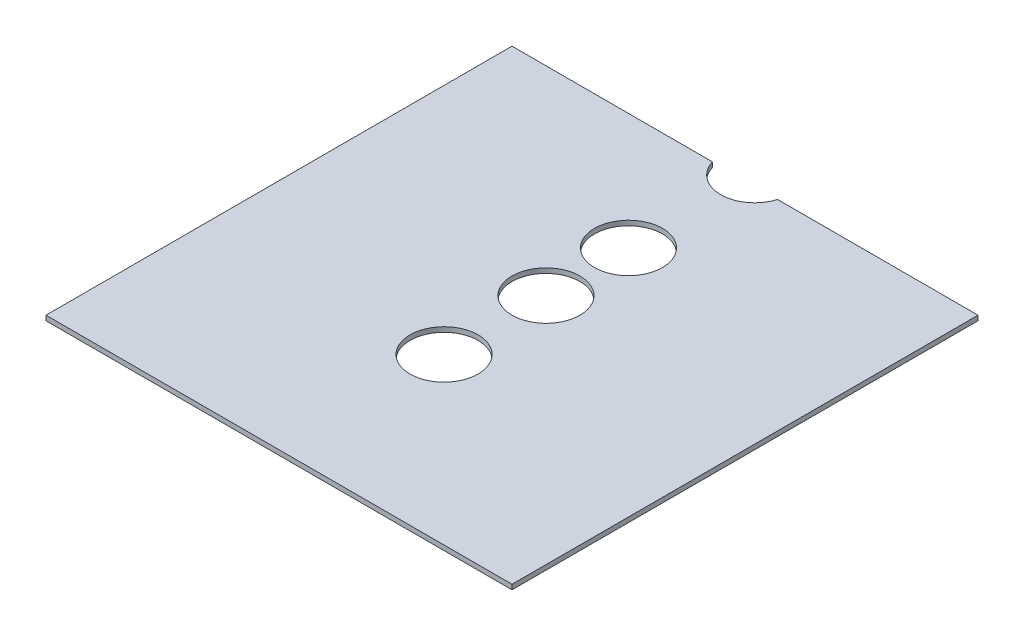
from build123d import *

# Parameters (mm, degrees)
SKETCH1_W              = 609.6
SKETCH1_H              = 609.6
BOSS_EXTRUDE1_DEPTH    = 6.35
CUT_EXTRUDE1_START     = -6.35
CUT_EXTRUDE1_OUTLINE_R = 44.45
CUT_EXTRUDE1_DEPTH     = 6.35


# Read off the part's stored shape, not the designer's step: Cut-Extrude1
with BuildPart() as part:
    # Sketch1 → Boss-Extrude1 (new body)
    with BuildSketch(Plane(origin=(0, 0, 0), x_dir=(1, 0, 0), z_dir=(0, 1, 0))):
        with Locations((-82.357575758, -23.090909091)):
            Rectangle(SKETCH1_W, SKETCH1_H)
    extrude(amount=BOSS_EXTRUDE1_DEPTH)

    # Cut-Extrude1 outline → Cut-Extrude1 (cut)
    with BuildSketch(Plane(origin=(0, 6.35, 0), x_dir=(1, 0, 0), z_dir=(0, 1, 0)).offset(CUT_EXTRUDE1_START)):
        with Locations((-82.357575758, 129.309090909)):
            Circle(CUT_EXTRUDE1_OUTLINE_R)
        with Locations((-82.357575758, 21.359090909)):
            Circle(CUT_EXTRUDE1_OUTLINE_R)
        with Locations((-82.357575758, -111.990909091)):
            Circle(CUT_EXTRUDE1_OUTLINE_R)
        with BuildLine():
            Line((-39.760480786, 281.709090909), (-124.954670729, 281.709090909))
            ThreePointArc((-124.954670729, 281.709090909), (-82.357575758, 249.959090909), (-39.760480786, 281.709090909))
        make_face()
    extrude(amount=CUT_EXTRUDE1_DEPTH, mode=Mode.SUBTRACT)


solid = part.part
